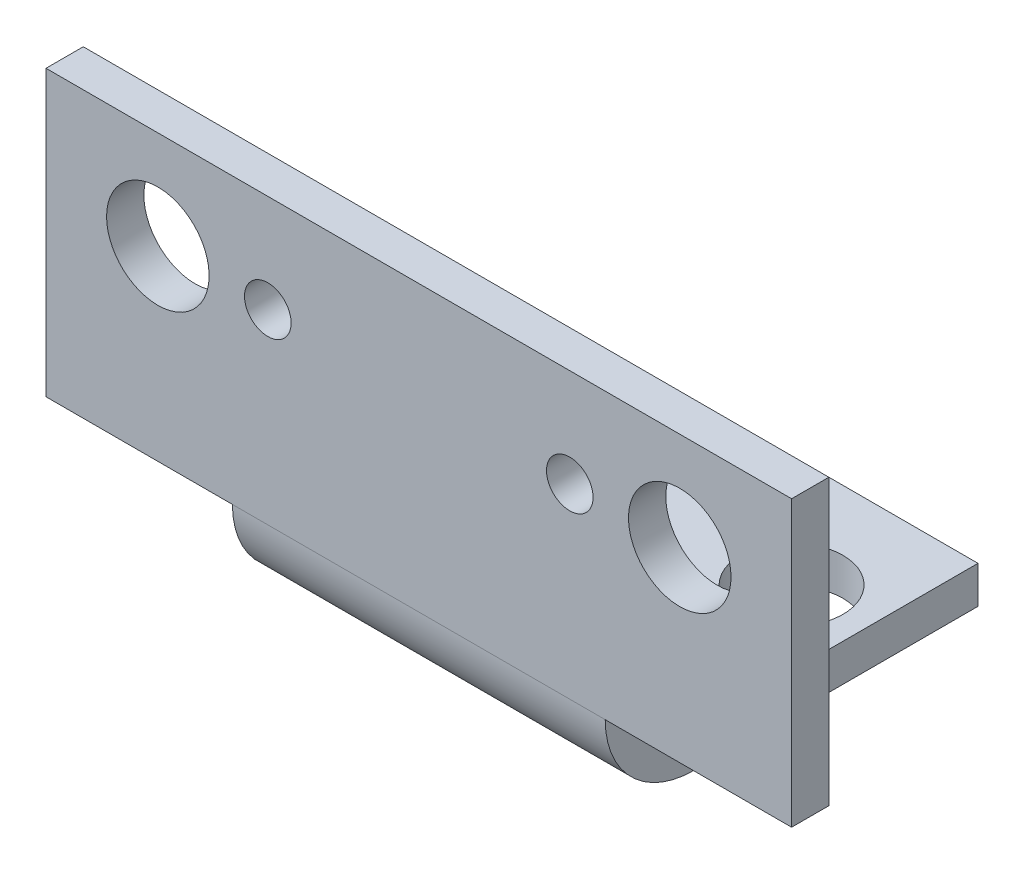
from build123d import *

# Parameters (mm, degrees)
SKETCH_1_W                       = 20
SKETCH_1_H                       = 20
SM_BASE_FLANGE_1_DEPTH           = 2
SM_EDGE_FLANGE_1_STRIP_W         = 13.4732
SM_EDGE_FLANGE_1_STRIP_H         = 2
SM_EDGE_FLANGE_1_STRIP_CUT_DEPTH = 20
SM_EDGE_FLANGE_1_DEPTH           = 20
SM_EDGE_FLANGE_1_PROFILE_W       = 40
SM_EDGE_FLANGE_1_PROFILE_H       = 15.2634
SM_EDGE_FLANGE_1_FLAT_DEPTH      = 2
SKETCH_9_R                       = 2.75
SKETCH_9_R_2                     = 1.25
CUT_EXTRUDE_1_DEPTH              = 10
SKETCH_10_R                      = 2.75
CUT_EXTRUDE_2_DEPTH              = 10


# Sheet-metal steps are written as plain solids
with BuildPart() as part:
    # Sketch 1 → 基体-法兰1 (new body)
    with BuildSketch(Plane(origin=(0, 0, 0), x_dir=(1, 0, 0), z_dir=(0, 1, 0))):
        Rectangle(SKETCH_1_W, SKETCH_1_H)
    extrude(amount=-SM_BASE_FLANGE_1_DEPTH)

    # 边线-法兰1 strip (across the edge) → 边线-法兰1 strip cut (cut)
    with BuildSketch(Plane(origin=(-10, 0, 10), x_dir=(0, 0, -1), z_dir=(1, 0, 0))):
        with Locations((-2, -1)):
            Rectangle(SM_EDGE_FLANGE_1_STRIP_W, SM_EDGE_FLANGE_1_STRIP_H)
    extrude(amount=SM_EDGE_FLANGE_1_STRIP_CUT_DEPTH, mode=Mode.SUBTRACT)

    # 边线-法兰1 bend section (across the edge) → 边线-法兰1 (add)
    with BuildSketch(Plane(origin=(-10, 0, 10), x_dir=(0, 0, -1), z_dir=(1, 0, 0))):
        with BuildLine():
            Line((0, 2.7366), (2, 2.7366))
            ThreePointArc((2, 2.7366), (2.801531583, 0.801531583), (4.7366, 0))
            Line((4.7366, 0), (4.7366, -2))
            ThreePointArc((4.7366, -2), (1.38731802, -0.61268198), (0, 2.7366))
        make_face()
    extrude(amount=SM_EDGE_FLANGE_1_DEPTH)

    # 边线-法兰1 profile (on flange) → 边线-法兰1 flat (add)
    with BuildSketch(Plane(origin=(0, 0, 10), x_dir=(-1, 0, 0), z_dir=(0, 0, -1))):
        with Locations((0, 10.3683)):
            Rectangle(SM_EDGE_FLANGE_1_PROFILE_W, SM_EDGE_FLANGE_1_PROFILE_H)
    extrude(amount=SM_EDGE_FLANGE_1_FLAT_DEPTH)

    # 草图9 → 切除-拉伸1 (cut)
    with BuildSketch(Plane.XY.offset(10)):
        with Locations((14, 12.7366)):
            Circle(SKETCH_9_R)
        with Locations((8.1, 12.7366)):
            Circle(SKETCH_9_R_2)
        with Locations(Location((-8.1, 12.7366, 0), (0, 0, 270))):
            Circle(SKETCH_9_R_2)
        with Locations(Location((-14, 12.7366, 0), (0, 0, 270))):
            Circle(SKETCH_9_R)
    extrude(amount=-CUT_EXTRUDE_1_DEPTH, mode=Mode.SUBTRACT)

    # 草图10 → 切除-拉伸2 (cut)
    with BuildSketch(Plane.XZ.offset(2)):
        with Locations(Location((6, -4, 0), (0, 0, 270))):
            Circle(SKETCH_10_R)
        with Locations(Location((-6, -4, 0), (0, 0, 270))):
            Circle(SKETCH_10_R)
    extrude(amount=-CUT_EXTRUDE_2_DEPTH, mode=Mode.SUBTRACT)


solid = part.part
